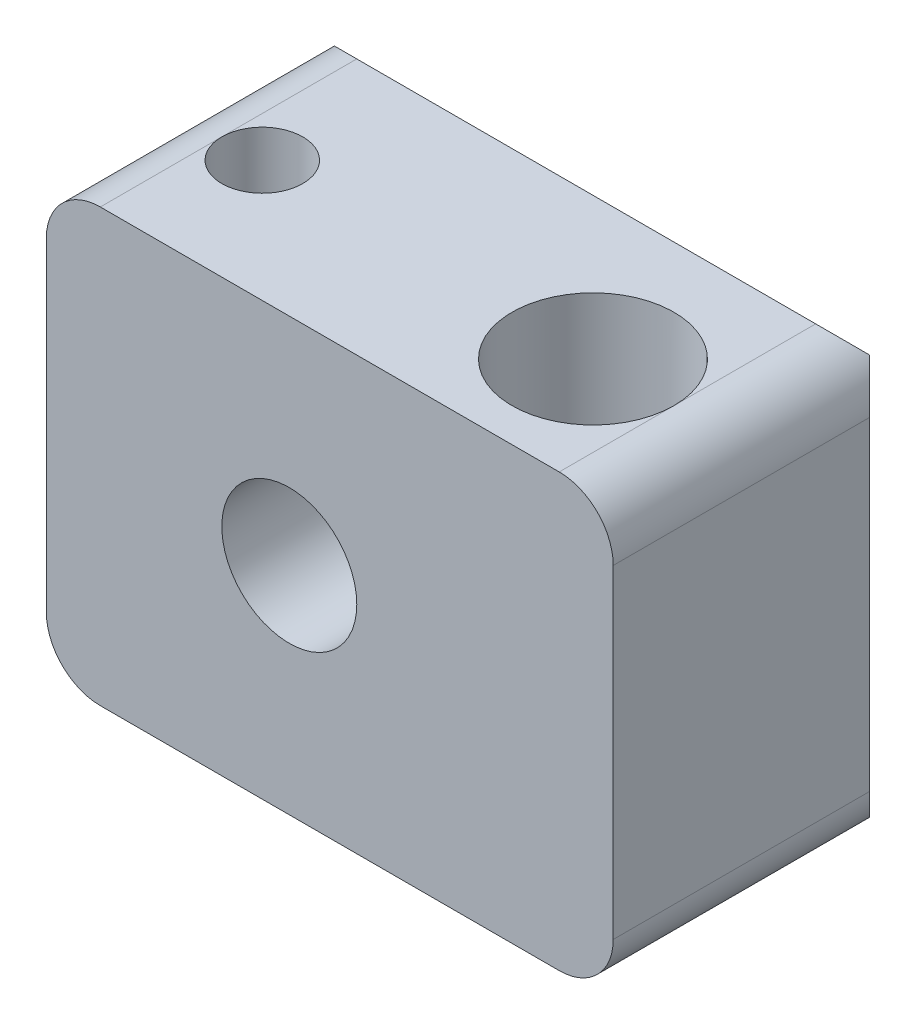
from build123d import *

# Parameters (mm, degrees)
SKETCH1_W                  = 21
SKETCH1_H                  = 16
BOSS_EXTRUDE1_DEPTH        = 11.5
F_10_CLEARANCE_HOLE1_D     = 5
F_12_CLEARANCE_HOLE1_D     = 6
F_2_CLEARANCE_HOLE1_REACH  = 19.507
F_2_CLEARANCE_HOLE1_BORE_R = 1.25
F_3_CLEARANCE_HOLE2_D      = 3
F_2_CLEARANCE_HOLE2_REACH  = 19.507
F_2_CLEARANCE_HOLE2_BORE_R = 1.25
CHAMFER2_SIZE              = 2
FILLET1_R                  = 2


with BuildPart() as part:
    # Sketch1 → Boss-Extrude1 (new body)
    with BuildSketch(Plane(origin=(0, 0, 0), x_dir=(-1, 0, 0), z_dir=(0, 0, -1))):
        Rectangle(SKETCH1_W, SKETCH1_H)
    extrude(amount=-BOSS_EXTRUDE1_DEPTH)

    # #10 Clearance Hole1 (through all)
    with Locations(Plane.XY.offset(11.5)):
        with Locations((-1.5, 0)):
            Hole(F_10_CLEARANCE_HOLE1_D / 2)

    # #12 Clearance Hole1 (through all)
    with Locations(Plane(origin=(0, 8, 0), x_dir=(1, 0, 0), z_dir=(0, 1, 0))):
        with Locations((5.5, -7.25)):
            Hole(F_12_CLEARANCE_HOLE1_D / 2)

    # #2 Clearance Hole1 bore → #2 Clearance Hole1 (cut, up to next)
    with BuildSketch(Plane(origin=(0, 0, 0), x_dir=(-1, 0, 0), z_dir=(0, 0, -1)), mode=Mode.PRIVATE) as f_2_clearance_hole1_sk1:
        with Locations((-5.5, 0)):
            Circle(F_2_CLEARANCE_HOLE1_BORE_R)
    f_2_clearance_hole1_tool1 = extrude(f_2_clearance_hole1_sk1.sketch, amount=-F_2_CLEARANCE_HOLE1_REACH, mode=Mode.PRIVATE) & part.part
    add(f_2_clearance_hole1_tool1.solids().sort_by_distance((5.5, 0, 0))[0], mode=Mode.SUBTRACT)

    # #3 Clearance Hole2 (through all)
    with Locations(Plane(origin=(0, -8, 0), x_dir=(-1, 0, 0), z_dir=(0, -1, 0))):
        with Locations((7, -7)):
            Hole(F_3_CLEARANCE_HOLE2_D / 2)

    # #2 Clearance Hole2 bore → #2 Clearance Hole2 (cut, up to next)
    with BuildSketch(Plane(origin=(0, 0, 0), x_dir=(-1, 0, 0), z_dir=(0, 0, -1)), mode=Mode.PRIVATE) as f_2_clearance_hole2_sk1:
        with Locations((7, 0)):
            Circle(F_2_CLEARANCE_HOLE2_BORE_R)
    f_2_clearance_hole2_tool1 = extrude(f_2_clearance_hole2_sk1.sketch, amount=-F_2_CLEARANCE_HOLE2_REACH, mode=Mode.PRIVATE) & part.part
    add(f_2_clearance_hole2_tool1.solids().sort_by_distance((-7, 0, 0))[0], mode=Mode.SUBTRACT)

    # Chamfer2
    chamfer2_edges = [part.edges().sort_by_distance(p)[0] for p in [
        (0, -8, 0),
        (10.5, 0, 0),
        (0, 8, 0),
        (-10.5, 0, 0),
    ]]
    chamfer(chamfer2_edges, length=CHAMFER2_SIZE)

    # Fillet1
    fillet1_edges = [part.edges().sort_by_distance(p)[0] for p in [
        (-10.5, -8, 6.75),
        (10.5, -8, 6.75),
        (10.5, 8, 6.75),
        (-10.5, 8, 6.75),
    ]]
    fillet(fillet1_edges, radius=FILLET1_R - 0.0001)  # a hair under: the kernel refuses the full size


solid = part.part
